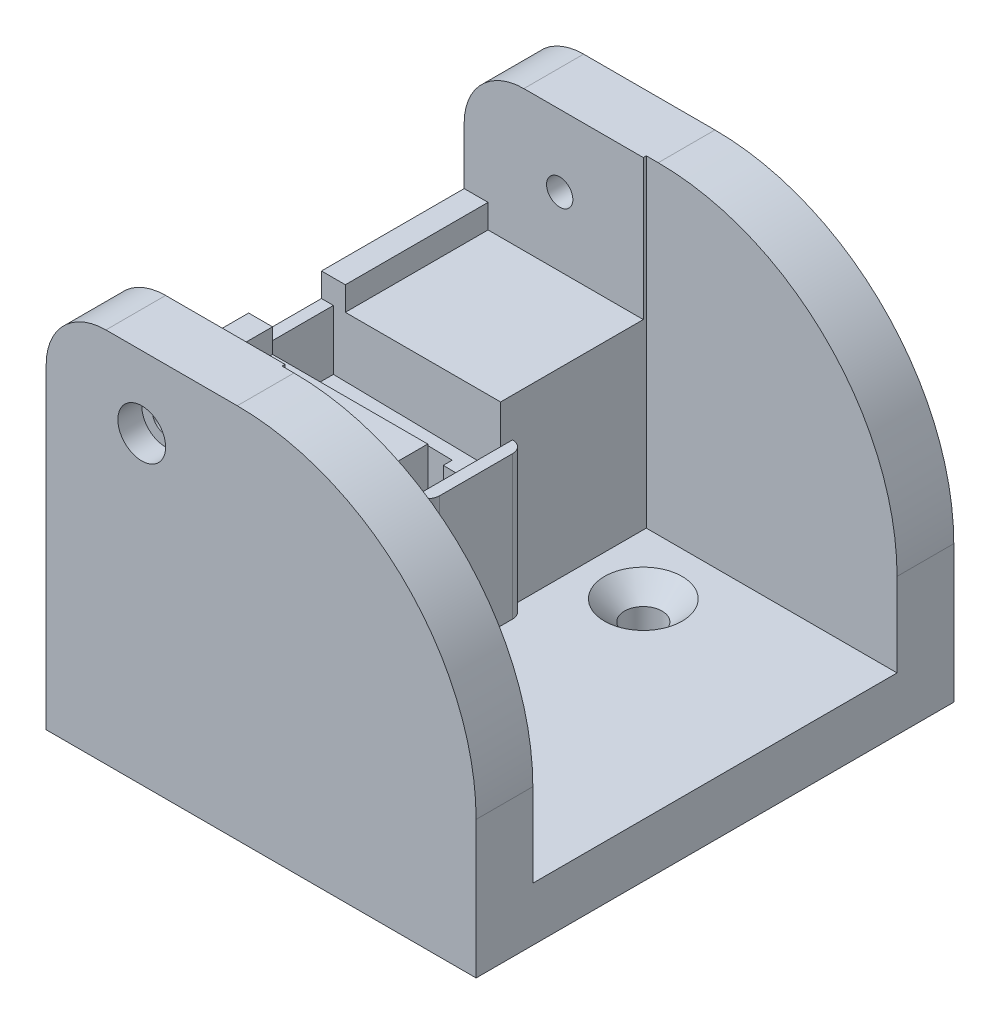
from build123d import *

# Parameters (mm, degrees)
BASE_W                              = 36
BASE_H                              = 30
BOSS_EXTRUDE1_DEPTH                 = 4.5
WALLS_W                             = 36
WALLS_H                             = 5
WALLS_EXT_DEPTH                     = 31.5
SWITCH_BLOCK_W                      = 15
SWITCH_BLOCK_H                      = 30
SWITCH_BLOCK_EXT_DEPTH              = 15.25
MAGNET_POCKET_R                     = 6.25
MAGNET_POCKET_CUT_DEPTH             = 3.75
FILLET1_R                           = 5
FILLET2_R                           = 5
FILLET3_R                           = 20
FILLET4_R                           = 20
SWITCH_PLACE_W                      = 14
SWITCH_PLACE_H                      = 6.1
SWITCH_POCKET_DEPTH                 = 5.25
SWITCH_CONTACTS_W                   = 14
SWITCH_CONTACTS_H                   = 2.5
SWITCH_LEADS_DEPTH                  = 7
SWITCH_ANGLE_LEFT_DEPTH             = 1.8
SWITCH_ANGLE_RIGHT_DEPTH            = 1.8
SKETCH20_W                          = 8.1
SKETCH20_H                          = 12
BOSS_EXTRUDE5_DEPTH                 = 1
FILLET5_R                           = 1
FILLET6_R                           = 1
WIRE_GUIDE_W                        = 8
WIRE_GUIDE_H                        = 4
WIRE_PASS_THROUGH_DEPTH             = 7.5
WIRE_PASS_THROUGH_DIRECTION_2_REACH = 38.056
WIRE_CHANNEL_OUTLINE_W              = 4
WIRE_CHANNEL_OUTLINE_H              = 4
WIRE_CHANNEL_DEPTH                  = 1.5
ACHSE_R                             = 1.1
M2_ACHSE_DEPTH                      = 55.002314765
M2_NUT_DEPTH                        = 2.5
SKETCH2_R                           = 1.575
M3_MOUNTING_SCREWS_DEPTH            = 4.5
SKETCH9_W                           = 2
SKETCH9_H                           = 2
BOSS_EXTRUDE3_DEPTH                 = 11.95
SKETCH10_W                          = 2
SKETCH10_H                          = 2
BOSS_EXTRUDE4_DEPTH                 = 11.95
SKETCH19_R                          = 2
SCREW_HEAD_DEPTH                    = 2
SKETCH21_W                          = 21
SKETCH21_H                          = 27
CUT_EXTRUDE2_DEPTH                  = 0.25
SKETCH22_W                          = 21
SKETCH22_H                          = 27
CUT_EXTRUDE3_DEPTH                  = 0.25


# Read off the part's stored shape, not the designer's step: Wire Channel
with BuildPart() as part:
    # Base → Boss-Extrude1 (new body)
    with BuildSketch(Plane(origin=(0, 0, 0), x_dir=(1, 0, 0), z_dir=(0, 1, 0))):
        Rectangle(BASE_W, BASE_H)
    extrude(amount=BOSS_EXTRUDE1_DEPTH)

    # Walls → Walls Ext (add)
    with BuildSketch(Plane.XZ):
        with Locations((0, 17.5)):
            Rectangle(WALLS_W, WALLS_H)
        with Locations((0, -17.5)):
            Rectangle(WALLS_W, WALLS_H)
    extrude(amount=-WALLS_EXT_DEPTH)

    # Switch Block → Switch Block Ext (add)
    with BuildSketch(Plane(origin=(0, 4.5, 0), x_dir=(1, 0, 0), z_dir=(0, 1, 0))):
        with Locations((-10.5, 0)):
            Rectangle(SWITCH_BLOCK_W, SWITCH_BLOCK_H)
    extrude(amount=SWITCH_BLOCK_EXT_DEPTH)

    # Magnet Pocket → Magnet Pocket Cut (cut)
    with BuildSketch(Plane(origin=(0, 0, 0), x_dir=(1, 0, 0), z_dir=(0, 1, 0))):
        with Locations(Location((10, 0, 0), (0, 0, 90))):
            Circle(MAGNET_POCKET_R)
    extrude(amount=MAGNET_POCKET_CUT_DEPTH, mode=Mode.SUBTRACT)

    # Fillet1
    fillet1_edges = [part.edges().sort_by_distance(p)[0] for p in [
        (-18, 31.5, -17.5),
    ]]
    fillet(fillet1_edges, radius=FILLET1_R)

    # Fillet2
    fillet2_edges = [part.edges().sort_by_distance(p)[0] for p in [
        (-18, 31.5, 17.5),
    ]]
    fillet(fillet2_edges, radius=FILLET2_R)

    # Fillet3
    fillet3_edges = [part.edges().sort_by_distance(p)[0] for p in [
        (18, 31.5, -17.5),
    ]]
    fillet(fillet3_edges, radius=FILLET3_R)

    # Fillet4
    fillet4_edges = [part.edges().sort_by_distance(p)[0] for p in [
        (18, 31.5, 17.5),
    ]]
    fillet(fillet4_edges, radius=FILLET4_R)

    # Switch Place → Switch Pocket (cut)
    with BuildSketch(Plane(origin=(0, 19.75, 0), x_dir=(1, 0, 0), z_dir=(0, 1, 0))):
        with Locations((-10, 0)):
            Rectangle(SWITCH_PLACE_W, SWITCH_PLACE_H)
    extrude(amount=-SWITCH_POCKET_DEPTH, mode=Mode.SUBTRACT)

    # Switch Contacts → Switch Leads (cut)
    with BuildSketch(Plane(origin=(0, 14.5, 0), x_dir=(1, 0, 0), z_dir=(0, 1, 0))):
        with Locations((-10, 0)):
            Rectangle(SWITCH_CONTACTS_W, SWITCH_CONTACTS_H)
    extrude(amount=-SWITCH_LEADS_DEPTH, mode=Mode.SUBTRACT)

    # Sketch16 → Switch Angle Left (add)
    with BuildSketch(Plane(origin=(0, 0, 3.05), x_dir=(-1, 0, 0), z_dir=(0, 0, -1))):
        Polygon((17, 14.5), (17, 14.75), (3, 14.5), align=None)
    extrude(amount=SWITCH_ANGLE_LEFT_DEPTH)

    # Sketch17 → Switch Angle Right (add)
    with BuildSketch(Plane.XY.offset(-3.05)):
        Polygon((-17, 14.5), (-17, 14.75), (-3, 14.5), align=None)
    extrude(amount=SWITCH_ANGLE_RIGHT_DEPTH)

    # Sketch20 → Boss-Extrude5 (add)
    with BuildSketch(Plane(origin=(-3, 0, 0), x_dir=(0, 0, -1), z_dir=(1, 0, 0))):
        with Locations((0, 10.5)):
            Rectangle(SKETCH20_W, SKETCH20_H)
    extrude(amount=BOSS_EXTRUDE5_DEPTH)

    # Fillet5
    fillet5_edges = [part.edges().sort_by_distance(p)[0] for p in [
        (-2, 10.5, 4.05),
    ]]
    fillet(fillet5_edges, radius=FILLET5_R - 0.0001)  # a hair under: the kernel refuses the full size

    # Fillet6
    fillet6_edges = [part.edges().sort_by_distance(p)[0] for p in [
        (-2, 10.5, -4.05),
    ]]
    fillet(fillet6_edges, radius=FILLET6_R - 0.0001)  # a hair under: the kernel refuses the full size

    # Wire Guide → Wire pass through (cut)
    with BuildSketch(Plane(origin=(0, 7.5, 0), x_dir=(1, 0, 0), z_dir=(0, 1, 0))):
        with Locations((-10, 0)):
            Rectangle(WIRE_GUIDE_W, WIRE_GUIDE_H)
    extrude(amount=-WIRE_PASS_THROUGH_DEPTH, mode=Mode.SUBTRACT)

    # Wire pass through direction 2: up to this plane
    wire_pass_through_direction_2_end = Plane(origin=(-17, 14.75, -12.752231965), z_dir=(-0.017854296416882947, -0.9998405993454447, 0))
    # Wire Guide → Wire pass through direction 2 (cut, up to the surface)
    with BuildSketch(Plane(origin=(0, 7.5, 0), x_dir=(1, 0, 0), z_dir=(0, 1, 0)), mode=Mode.PRIVATE) as wire_pass_through_direction_2_sk1:
        with Locations((-10, 0)):
            Rectangle(WIRE_GUIDE_W, WIRE_GUIDE_H)
    wire_pass_through_direction_2_tool1 = split(extrude(wire_pass_through_direction_2_sk1.sketch, amount=WIRE_PASS_THROUGH_DIRECTION_2_REACH, mode=Mode.PRIVATE), bisect_by=wire_pass_through_direction_2_end, keep=Keep.BOTH, mode=Mode.PRIVATE)
    add(wire_pass_through_direction_2_tool1.solids().sort_by_distance((-10, 7.5, 0))[0], mode=Mode.SUBTRACT)

    # Wire Channel outline → Wire Channel (cut)
    with BuildSketch(Plane(origin=(0, 0, 0), x_dir=(1, 0, 0), z_dir=(0, 1, 0))):
        with Locations((-16, 0)):
            Rectangle(WIRE_CHANNEL_OUTLINE_W, WIRE_CHANNEL_OUTLINE_H)
        with BuildLine():
            Line((-6, 2), (-6, -2))
            Line((-6, -2), (0.968804066, -2))
            ThreePointArc((0.968804066, -2), (0.75, 0), (0.968804066, 2))
            Line((0.968804066, 2), (-6, 2))
        make_face()
    extrude(amount=WIRE_CHANNEL_DEPTH, mode=Mode.SUBTRACT)

    # Achse → M2 Achse (cut, through all)
    with BuildSketch(Plane.XY.offset(20)):
        with Locations((-10, 25.5)):
            Circle(ACHSE_R)
    extrude(amount=-M2_ACHSE_DEPTH, mode=Mode.SUBTRACT)

    # Sketch5 → M2 Nut (cut)
    with BuildSketch(Plane(origin=(0, 0, -20), x_dir=(-1, 0, 0), z_dir=(0, 0, -1))):
        Polygon((10, 27.6), (8.181346652, 26.55), (8.181346652, 24.45), (10, 23.4), (11.818653348, 24.45), (11.818653348, 26.55), align=None)
    extrude(amount=-M2_NUT_DEPTH, mode=Mode.SUBTRACT)

    # Sketch2 → M3 Mounting Screws (cut)
    with BuildSketch(Plane.XZ):
        with Locations(Location((2, -10, 0), (0, 0, 270))):
            Circle(SKETCH2_R)
        with Locations(Location((2, 10, 0), (0, 0, 270))):
            Circle(SKETCH2_R)
    extrude(amount=-M3_MOUNTING_SCREWS_DEPTH, mode=Mode.SUBTRACT)

    # M3 Senkkopf cone 1 section (through the dimple's axis) → M3 Senkkopf (revolve, cut)
    with BuildSketch(Plane(origin=(2, 4.5, 10), x_dir=(0, 0, 1), z_dir=(1, 0, 0))):
        Polygon((0, 0), (3.25, 0), (0, 3.25), align=None)
    revolve(axis=Axis((2, 4.5, 10), (0, -1, 0)), mode=Mode.SUBTRACT)

    # M3 Senkkopf cone 2 section (through the dimple's axis) → M3 Senkkopf cone 2 (revolve, cut)
    with BuildSketch(Plane(origin=(2, 4.5, -10), x_dir=(0, 0, 1), z_dir=(1, 0, 0))):
        Polygon((0, 0), (3.25, 0), (0, 3.25), align=None)
    revolve(axis=Axis((2, 4.5, -10), (0, -1, 0)), mode=Mode.SUBTRACT)

    # Sketch9 → Boss-Extrude3 (add)
    with BuildSketch(Plane.XY.offset(-15)):
        with Locations((-17, 20.75)):
            Rectangle(SKETCH9_W, SKETCH9_H)
    extrude(amount=BOSS_EXTRUDE3_DEPTH)

    # Sketch10 → Boss-Extrude4 (add)
    with BuildSketch(Plane(origin=(0, 0, 15), x_dir=(-1, 0, 0), z_dir=(0, 0, -1))):
        with Locations((17, 20.75)):
            Rectangle(SKETCH10_W, SKETCH10_H)
    extrude(amount=BOSS_EXTRUDE4_DEPTH)

    # Sketch19 → Screw Head (cut)
    with BuildSketch(Plane.XY.offset(20)):
        with Locations((-10, 25.5)):
            Circle(SKETCH19_R)
    extrude(amount=-SCREW_HEAD_DEPTH, mode=Mode.SUBTRACT)

    # Sketch21 → Cut-Extrude2 (cut)
    with BuildSketch(Plane(origin=(0, 0, 15), x_dir=(-1, 0, 0), z_dir=(0, 0, -1))):
        with Locations((-7.5, 18)):
            Rectangle(SKETCH21_W, SKETCH21_H)
    extrude(amount=-CUT_EXTRUDE2_DEPTH, mode=Mode.SUBTRACT)

    # Sketch22 → Cut-Extrude3 (cut)
    with BuildSketch(Plane.XY.offset(-15)):
        with Locations((7.5, 18)):
            Rectangle(SKETCH22_W, SKETCH22_H)
    extrude(amount=-CUT_EXTRUDE3_DEPTH, mode=Mode.SUBTRACT)


solid = part.part
